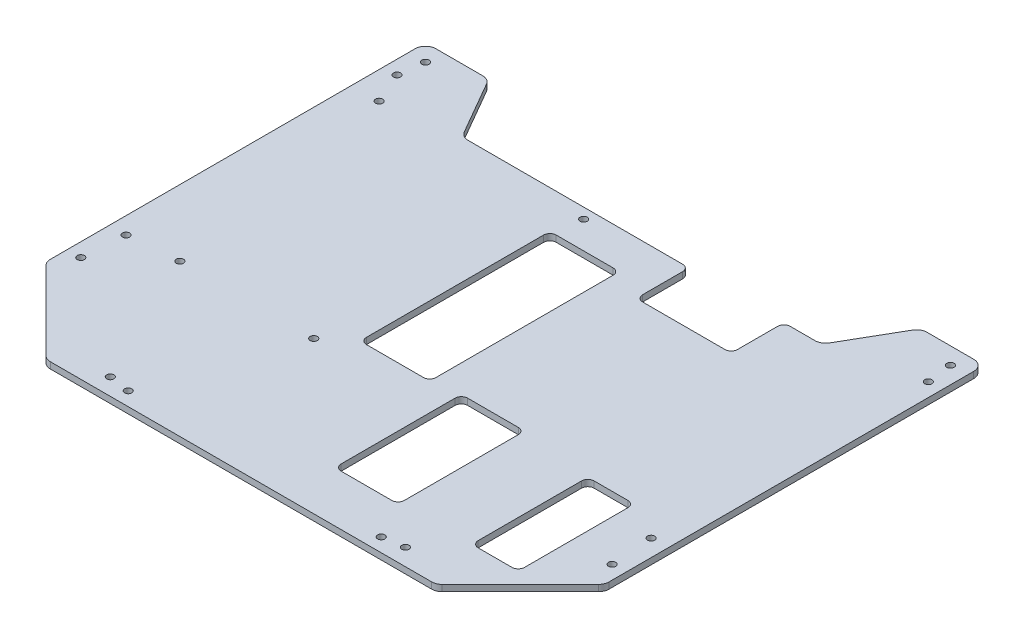
from build123d import *

# Parameters (mm, degrees)
BOSS_EXTRU_1_DEPTH      = 3
CONG_1_R                = 5
ESQUISSE2_R             = 1
ESQUISSE2_R_2           = 1.5
ENL_V_MAT_EXTRU_1_DEPTH = 257.837010573
D_GAGEMENT_M31_D        = 3.4
ESQUISSE5_W             = 45
ESQUISSE5_H             = 25
ESQUISSE5_W_2           = 33
ESQUISSE5_H_2           = 90
ESQUISSE5_W_3           = 22
ESQUISSE5_H_3           = 55
ESQUISSE5_W_4           = 30
ESQUISSE5_H_4           = 60
ENL_V_MAT_EXTRU_2_DEPTH = 257.837010573
CONG_2_R                = 3


with BuildPart() as part:
    # Esquisse1 → Boss.-Extru.1 (new body)
    with BuildSketch(Plane(origin=(0, 0, 0), x_dir=(1, 0, 0), z_dir=(0, 1, 0))):
        Polygon((-92.5, 0), (92.5, 0), (132.5, 40), (132.5, 220), (102.5, 220), (85.179491924, 190), (-85.179491924, 190), (-102.5, 220), (-132.5, 220), (-132.5, 40), align=None)
    extrude(amount=BOSS_EXTRU_1_DEPTH)

    # Congé1
    cong_1_edges = [part.edges().sort_by_distance(p)[0] for p in [
        (132.5, 1.5, -220),
        (102.5, 1.5, -220),
        (85.179491924, 1.5, -190),
        (-85.179491924, 1.5, -190),
        (-102.5, 1.5, -220),
        (-132.5, 1.5, -220),
        (-132.5, 1.5, -40),
        (-92.5, 1.5, 0),
        (92.5, 1.5, 0),
        (132.5, 1.5, -40),
    ]]
    fillet(cong_1_edges, radius=CONG_1_R)

    # Esquisse2 → Enlèv. mat.-Extru.1 (cut, through all)
    with BuildSketch(Plane.XZ):
        with Locations((-70, -8)):
            Circle(ESQUISSE2_R)
        with Locations((-124.5, -70)):
            Circle(ESQUISSE2_R)
        with Locations((-124.5, -212)):
            Circle(ESQUISSE2_R)
        with Locations((124.5, -212)):
            Circle(ESQUISSE2_R)
        with Locations((124.5, -70)):
            Circle(ESQUISSE2_R)
        with Locations((70, -8)):
            Circle(ESQUISSE2_R)
        with Locations((126, -50)):
            Circle(ESQUISSE2_R_2)
        with Locations((126, -200)):
            Circle(ESQUISSE2_R_2)
        with Locations((-60, -6.5)):
            Circle(ESQUISSE2_R_2)
        with Locations((60, -6.5)):
            Circle(ESQUISSE2_R_2)
        with Locations((-126, -50)):
            Circle(ESQUISSE2_R_2)
        with Locations((-126, -200)):
            Circle(ESQUISSE2_R_2)
        with Locations((-119.5, -185)):
            Circle(ESQUISSE2_R_2)
        with Locations((-22.5, -185)):
            Circle(ESQUISSE2_R_2)
        with Locations((-101, -72)):
            Circle(ESQUISSE2_R_2)
        with Locations((-37.5, -72)):
            Circle(ESQUISSE2_R_2)
    extrude(amount=-ENL_V_MAT_EXTRU_1_DEPTH, mode=Mode.SUBTRACT)

    # Dégagement M31 (through all)
    with Locations(Plane(origin=(0, 0, 0), x_dir=(-1, 0, 0), z_dir=(0, -1, 0))):
        with Locations((-70, 8), (-124.5, 70), (-124.5, 212), (124.5, 212), (124.5, 70), (70, 8), (-126, 200), (-126, 50), (-60, 6.5), (60, 6.5), (126, 50), (126, 200), (101, 72), (37.5, 72), (119.5, 185), (22.5, 185)):
            Hole(D_GAGEMENT_M31_D / 2)

    # Esquisse5 → Enlèv. mat.-Extru.2 (cut, through all)
    with BuildSketch(Plane.XZ):
        with Locations((45, -177.5)):
            Rectangle(ESQUISSE5_W, ESQUISSE5_H)
        with Locations((-9, -127)):
            Rectangle(ESQUISSE5_W_2, ESQUISSE5_H_2)
        with Locations((95.5, -52.5)):
            Rectangle(ESQUISSE5_W_3, ESQUISSE5_H_3)
        with Locations((35.5, -54)):
            Rectangle(ESQUISSE5_W_4, ESQUISSE5_H_4)
    extrude(amount=-ENL_V_MAT_EXTRU_2_DEPTH, mode=Mode.SUBTRACT)

    # Congé2
    cong_2_edges = [part.edges().sort_by_distance(p)[0] for p in [
        (67.5, 1.5, -190),
        (67.5, 1.5, -165),
        (22.5, 1.5, -165),
        (22.5, 1.5, -190),
        (106.5, 1.5, -80),
        (84.5, 1.5, -80),
        (84.5, 1.5, -25),
        (106.5, 1.5, -25),
        (7.5, 1.5, -82),
        (7.5, 1.5, -172),
        (-25.5, 1.5, -82),
        (-25.5, 1.5, -172),
        (50.5, 1.5, -84),
        (20.5, 1.5, -84),
        (50.5, 1.5, -24),
        (20.5, 1.5, -24),
    ]]
    fillet(cong_2_edges, radius=CONG_2_R)


solid = part.part
